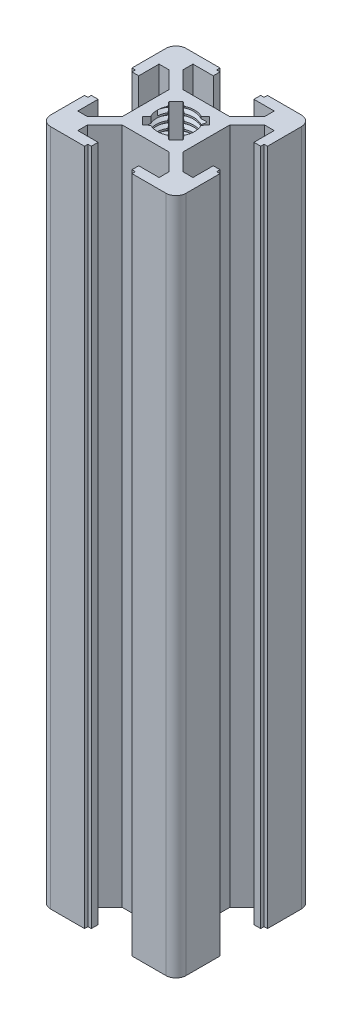
from build123d import *

# Parameters (mm, degrees)
DODANIE_WYCI_GNI_CIE1_DEPTH = 100
THREAD1_PITCH               = 1
THREAD2_PITCH               = 1


with BuildPart() as part:
    # Szkic1 → Dodanie-wyciągnięcie1 (new body)
    # profile 1 of 5: a face of its own
    with BuildSketch(Plane(origin=(0, 0, 0), x_dir=(1, 0, 0), z_dir=(0, 1, 0))):
        with BuildLine():
            Line((-7.06, 6), (-4.5, 3.440546933))
            Line((-4.5, 3.440546933), (-4.5, 4.5))
            Line((-4.5, 4.5), (-3.440546933, 4.5))
            Line((-3.440546933, 4.5), (-6, 7.06))
            Line((-6, 7.06), (-6, 8.5))
            Line((-6, 8.5), (-3, 8.5))
            Line((-3, 8.5), (-3, 9.5))
            Line((-3, 9.5), (-3.5, 9.5))
            Line((-3.5, 9.5), (-3.5, 10))
            Line((-3.5, 10), (-8.5, 10))
            ThreePointArc((-8.5, 10), (-9.560660172, 9.560660172), (-10, 8.5))
            Line((-10, 8.5), (-10, 3.5))
            Line((-10, 3.5), (-9.5, 3.5))
            Line((-9.5, 3.5), (-9.5, 3))
            Line((-9.5, 3), (-8.5, 3))
            Line((-8.5, 3), (-8.5, 6))
            Line((-8.5, 6), (-7.06, 6))
        make_face()
    # profile 2 of 5: a face of its own
    with BuildSketch(Plane(origin=(0, 0, 0), x_dir=(1, 0, 0), z_dir=(0, 1, 0))):
        with BuildLine():
            Line((4.5, 4.5), (4.5, 3.440546933))
            Line((4.5, 3.440546933), (7.06, 6))
            Line((7.06, 6), (8.5, 6))
            Line((8.5, 6), (8.5, 3))
            Line((8.5, 3), (9.5, 3))
            Line((9.5, 3), (9.5, 3.5))
            Line((9.5, 3.5), (10, 3.5))
            Line((10, 3.5), (10, 8.5))
            ThreePointArc((10, 8.5), (9.560660172, 9.560660172), (8.5, 10))
            Line((8.5, 10), (3.5, 10))
            Line((3.5, 10), (3.5, 9.5))
            Line((3.5, 9.5), (3, 9.5))
            Line((3, 9.5), (3, 8.5))
            Line((3, 8.5), (6, 8.5))
            Line((6, 8.5), (6, 7.06))
            Line((6, 7.06), (3.440546933, 4.5))
            Line((3.440546933, 4.5), (4.5, 4.5))
        make_face()
    # profile 3 of 5: a face of its own
    with BuildSketch(Plane(origin=(0, 0, 0), x_dir=(1, 0, 0), z_dir=(0, 1, 0))):
        Polygon((3.440546933, -4.5), (4.5, -4.5), (4.5, -3.440546933), (4.5, 3.440546933), (4.5, 4.5), (3.440546933, 4.5), (-3.440546933, 4.5), (-4.5, 4.5), (-4.5, 3.440546933), (-4.5, -3.440546933), (-4.5, -4.5), (-3.440546933, -4.5), align=None)
        with BuildLine():
            Line((-3.00520382, 1.944543648), (-1.944543648, 3.00520382))
            Line((-1.944543648, 3.00520382), (-1.271309214, 2.438498079))
            ThreePointArc((-1.271309214, 2.438498079), (0, 2.75), (1.271309214, 2.438498079))
            Line((1.271309214, 2.438498079), (1.944543648, 3.00520382))
            Line((1.944543648, 3.00520382), (3.00520382, 1.944543648))
            Line((3.00520382, 1.944543648), (2.438498079, 1.271309214))
            ThreePointArc((2.438498079, 1.271309214), (2.670989491, 0.654457899), (2.75, 0))
            ThreePointArc((2.75, 0), (2.670989491, -0.654457899), (2.438498079, -1.271309214))
            Line((2.438498079, -1.271309214), (3.00520382, -1.944543648))
            Line((3.00520382, -1.944543648), (1.944543648, -3.00520382))
            Line((1.944543648, -3.00520382), (1.271309214, -2.438498079))
            ThreePointArc((1.271309214, -2.438498079), (0, -2.75), (-1.271309214, -2.438498079))
            Line((-1.271309214, -2.438498079), (-1.944543648, -3.00520382))
            Line((-1.944543648, -3.00520382), (-3.00520382, -1.944543648))
            Line((-3.00520382, -1.944543648), (-2.438498079, -1.271309214))
            ThreePointArc((-2.438498079, -1.271309214), (-2.75, 0), (-2.438498079, 1.271309214))
            Line((-2.438498079, 1.271309214), (-3.00520382, 1.944543648))
        make_face(mode=Mode.SUBTRACT)
    # profile 4 of 5: a face of its own
    with BuildSketch(Plane(origin=(0, 0, 0), x_dir=(1, 0, 0), z_dir=(0, 1, 0))):
        with BuildLine():
            Line((-6, -7.06), (-3.440546933, -4.5))
            Line((-3.440546933, -4.5), (-4.5, -4.5))
            Line((-4.5, -4.5), (-4.5, -3.440546933))
            Line((-4.5, -3.440546933), (-7.06, -6))
            Line((-7.06, -6), (-8.5, -6))
            Line((-8.5, -6), (-8.5, -3))
            Line((-8.5, -3), (-9.5, -3))
            Line((-9.5, -3), (-9.5, -3.5))
            Line((-9.5, -3.5), (-10, -3.5))
            Line((-10, -3.5), (-10, -8.5))
            ThreePointArc((-10, -8.5), (-9.560660172, -9.560660172), (-8.5, -10))
            Line((-8.5, -10), (-3.5, -10))
            Line((-3.5, -10), (-3.5, -9.5))
            Line((-3.5, -9.5), (-3, -9.5))
            Line((-3, -9.5), (-3, -8.5))
            Line((-3, -8.5), (-6, -8.5))
            Line((-6, -8.5), (-6, -7.06))
        make_face()
    # profile 5 of 5: a face of its own
    with BuildSketch(Plane(origin=(0, 0, 0), x_dir=(1, 0, 0), z_dir=(0, 1, 0))):
        with BuildLine():
            Line((4.5, -3.440546933), (4.5, -4.5))
            Line((4.5, -4.5), (3.440546933, -4.5))
            Line((3.440546933, -4.5), (6, -7.06))
            Line((6, -7.06), (6, -8.5))
            Line((6, -8.5), (3, -8.5))
            Line((3, -8.5), (3, -9.5))
            Line((3, -9.5), (3.5, -9.5))
            Line((3.5, -9.5), (3.5, -10))
            Line((3.5, -10), (8.5, -10))
            ThreePointArc((8.5, -10), (9.560660172, -9.560660172), (10, -8.5))
            Line((10, -8.5), (10, -3.5))
            Line((10, -3.5), (9.5, -3.5))
            Line((9.5, -3.5), (9.5, -3))
            Line((9.5, -3), (8.5, -3))
            Line((8.5, -3), (8.5, -6))
            Line((8.5, -6), (7.06, -6))
            Line((7.06, -6), (4.5, -3.440546933))
        make_face()
    extrude(amount=DODANIE_WYCI_GNI_CIE1_DEPTH)

    # Thread1: arcs per turn and ends read off the stored shape
    # Thread1: the profile of Thread Profile1 profile screwed along a right-hand helix through 30 turns, 8 arcs to a turn; built about Z, then put on its axis
    thread1_z = Axis((0, 0, 0), (0, 0, 1))
    thread1_corners = [(2.7497, 0, -0.000173205), (3.291265875, 0, 0.312499999), (3.291265875, 0, 0.437499999), (2.7497, 0, 0.750173202)]
    with BuildLine(mode=Mode.PRIVATE) as thread1_profile:
        Line(thread1_corners[0], thread1_corners[1])
        Line(thread1_corners[1], thread1_corners[2])
        Line(thread1_corners[2], thread1_corners[3])
        Line(thread1_corners[3], thread1_corners[0])
    thread1_cap = Face(thread1_profile.wire())
    thread1_turn_angles = [0, 22.5, 45, 67.5, 90, 112.5, 135, 157.5, 180, 202.5, 225, 247.5, 270, 292.5, 315, 337.5, 360]
    thread1_turn_weights = [1, 0.9238795325112867, 1, 0.9238795325112867, 1, 0.9238795325112867, 1, 0.9238795325112867, 1, 0.9238795325112867, 1, 0.9238795325112867, 1, 0.9238795325112867, 1, 0.9238795325112867, 1]
    thread1_turn_rails = [Edge.make_bspline([Vector(p[0], p[1], 0).rotate(thread1_z, thread1_turn_angles[k]) / thread1_turn_weights[k] + Vector(0, 0, p[2] + THREAD1_PITCH * thread1_turn_angles[k] / 360) for k in range(17)], [0, 0, 0, 1, 1, 2, 2, 3, 3, 4, 4, 5, 5, 6, 6, 7, 7, 8, 8, 8], 2, thread1_turn_weights) for p in thread1_corners]
    thread1_turn_sides = [Face.make_surface_from_curves(thread1_turn_rails[p[0]], thread1_turn_rails[p[1]]) for p in [(0, 1), (1, 2), (2, 3), (3, 0)]]
    thread1 = Plane(origin=(0, 100, 0), x_dir=(-1, 0, 0), z_dir=(0, -1, 0)) * Solid(Shell([*[p.moved(Location((0, 0, THREAD1_PITCH * i))) for i in range(30) for p in thread1_turn_sides], thread1_cap, thread1_cap.rotate(thread1_z, 10800).moved(Location((0, 0, THREAD1_PITCH * 10800 / 360)))]))
    add(thread1, mode=Mode.SUBTRACT)

    # Thread2: arcs per turn and ends read off the stored shape
    # Thread2: the profile of Thread Profile2 profile screwed along a right-hand helix through 30 turns, 8 arcs to a turn; built about Z, then put on its axis
    thread2_z = Axis((0, 0, 0), (0, 0, 1))
    thread2_corners = [(2.7497, 0, -0.000173205), (3.291265875, 0, 0.312499999), (3.291265875, 0, 0.437499999), (2.7497, 0, 0.750173202)]
    with BuildLine(mode=Mode.PRIVATE) as thread2_profile:
        Line(thread2_corners[0], thread2_corners[1])
        Line(thread2_corners[1], thread2_corners[2])
        Line(thread2_corners[2], thread2_corners[3])
        Line(thread2_corners[3], thread2_corners[0])
    thread2_cap = Face(thread2_profile.wire())
    thread2_turn_angles = [0, 22.5, 45, 67.5, 90, 112.5, 135, 157.5, 180, 202.5, 225, 247.5, 270, 292.5, 315, 337.5, 360]
    thread2_turn_weights = [1, 0.9238795325112867, 1, 0.9238795325112867, 1, 0.9238795325112867, 1, 0.9238795325112867, 1, 0.9238795325112867, 1, 0.9238795325112867, 1, 0.9238795325112867, 1, 0.9238795325112867, 1]
    thread2_turn_rails = [Edge.make_bspline([Vector(p[0], p[1], 0).rotate(thread2_z, thread2_turn_angles[k]) / thread2_turn_weights[k] + Vector(0, 0, p[2] + THREAD2_PITCH * thread2_turn_angles[k] / 360) for k in range(17)], [0, 0, 0, 1, 1, 2, 2, 3, 3, 4, 4, 5, 5, 6, 6, 7, 7, 8, 8, 8], 2, thread2_turn_weights) for p in thread2_corners]
    thread2_turn_sides = [Face.make_surface_from_curves(thread2_turn_rails[p[0]], thread2_turn_rails[p[1]]) for p in [(0, 1), (1, 2), (2, 3), (3, 0)]]
    thread2 = Plane(origin=(0, 0, 0), x_dir=(1, 0, 0), z_dir=(0, 1, 0)) * Solid(Shell([*[p.moved(Location((0, 0, THREAD2_PITCH * i))) for i in range(30) for p in thread2_turn_sides], thread2_cap, thread2_cap.rotate(thread2_z, 10800).moved(Location((0, 0, THREAD2_PITCH * 10800 / 360)))]))
    add(thread2, mode=Mode.SUBTRACT)


solid = part.part
